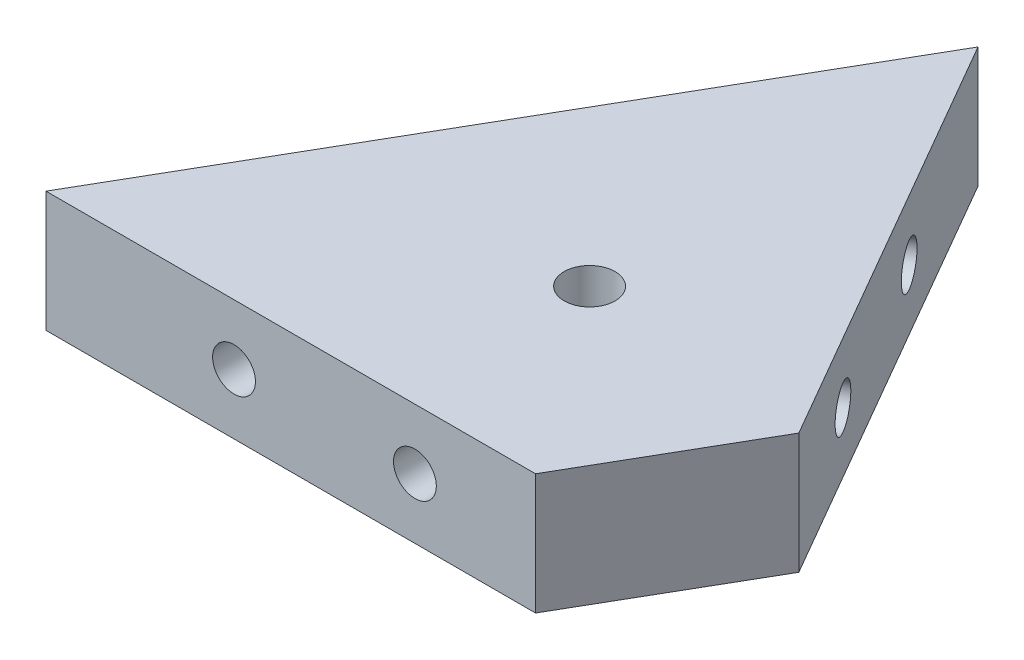
from build123d import *

# Parameters (mm, degrees)
BOSS_EXTRUDE1_DEPTH = 25.4
SKETCH2_R           = 4.5085
CUT_EXTRUDE1_DEPTH  = 12.7
SKETCH3_R           = 3.2639
CUT_EXTRUDE2_DEPTH  = 12.7
SKETCH4_R           = 3.2639
CUT_EXTRUDE3_DEPTH  = 12.7
SKETCH5_R           = 5.3578125
CUT_EXTRUDE4_DEPTH  = 280.690442894


with BuildPart() as part:
    # Sketch1 → Boss-Extrude1 (new body)
    with BuildSketch(Plane(origin=(0, 0, 0), x_dir=(1, 0, 0), z_dir=(0, 1, 0))):
        Polygon((119.068292428, -241.162389864), (129.21607637, -223.585912492), (51.895065274, -178.944605922), (15.973610966, -241.162389864), align=None)
    boss_extrude1 = extrude(amount=BOSS_EXTRUDE1_DEPTH)

    # Sketch2 → Cut-Extrude1 (cut)
    with BuildSketch(Plane.XY.offset(241.162389864)):
        with Locations((55.568292428, 12.7)):
            Circle(SKETCH2_R)
        with Locations((93.668292428, 12.7)):
            Circle(SKETCH2_R)
    cut_extrude1 = extrude(amount=-CUT_EXTRUDE1_DEPTH, mode=Mode.SUBTRACT)

    # Sketch3 → Cut-Extrude2 (cut)
    with BuildSketch(Plane.XY.offset(228.462389864)):
        with Locations((55.568292428, 12.7)):
            Circle(SKETCH3_R)
    cut_extrude2 = extrude(amount=-CUT_EXTRUDE2_DEPTH, mode=Mode.SUBTRACT)

    # Sketch4 → Cut-Extrude3 (cut)
    with BuildSketch(Plane.XY.offset(228.462389864)):
        with Locations((93.668292428, 12.7)):
            Circle(SKETCH4_R)
    cut_extrude3 = extrude(amount=-CUT_EXTRUDE3_DEPTH, mode=Mode.SUBTRACT)

    # Mirror1: Boss-Extrude1, Cut-Extrude1, Cut-Extrude2, Cut-Extrude3 across plane
    add(boss_extrude1.mirror(Plane(origin=(51.895065274, 25.4, 178.944605922), x_dir=(0.8660254037844389, 0, 0.4999999999999996), z_dir=(-0.49999999999999983, 0, 0.8660254037844388))))
    add(cut_extrude1.mirror(Plane(origin=(51.895065274, 25.4, 178.944605922), x_dir=(0.8660254037844389, 0, 0.4999999999999996), z_dir=(-0.49999999999999983, 0, 0.8660254037844388))), mode=Mode.SUBTRACT)
    add(cut_extrude2.mirror(Plane(origin=(51.895065274, 25.4, 178.944605922), x_dir=(0.8660254037844389, 0, 0.4999999999999996), z_dir=(-0.49999999999999983, 0, 0.8660254037844388))), mode=Mode.SUBTRACT)
    add(cut_extrude3.mirror(Plane(origin=(51.895065274, 25.4, 178.944605922), x_dir=(0.8660254037844389, 0, 0.4999999999999996), z_dir=(-0.49999999999999983, 0, 0.8660254037844388))), mode=Mode.SUBTRACT)

    # Sketch5 → Cut-Extrude4 (cut, through all)
    with BuildSketch(Plane(origin=(0, 25.4, 0), x_dir=(1, 0, 0), z_dir=(0, 1, 0))):
        with Locations((90.555570822, -201.265259207)):
            Circle(SKETCH5_R)
    extrude(amount=-CUT_EXTRUDE4_DEPTH, mode=Mode.SUBTRACT)


solid = part.part
